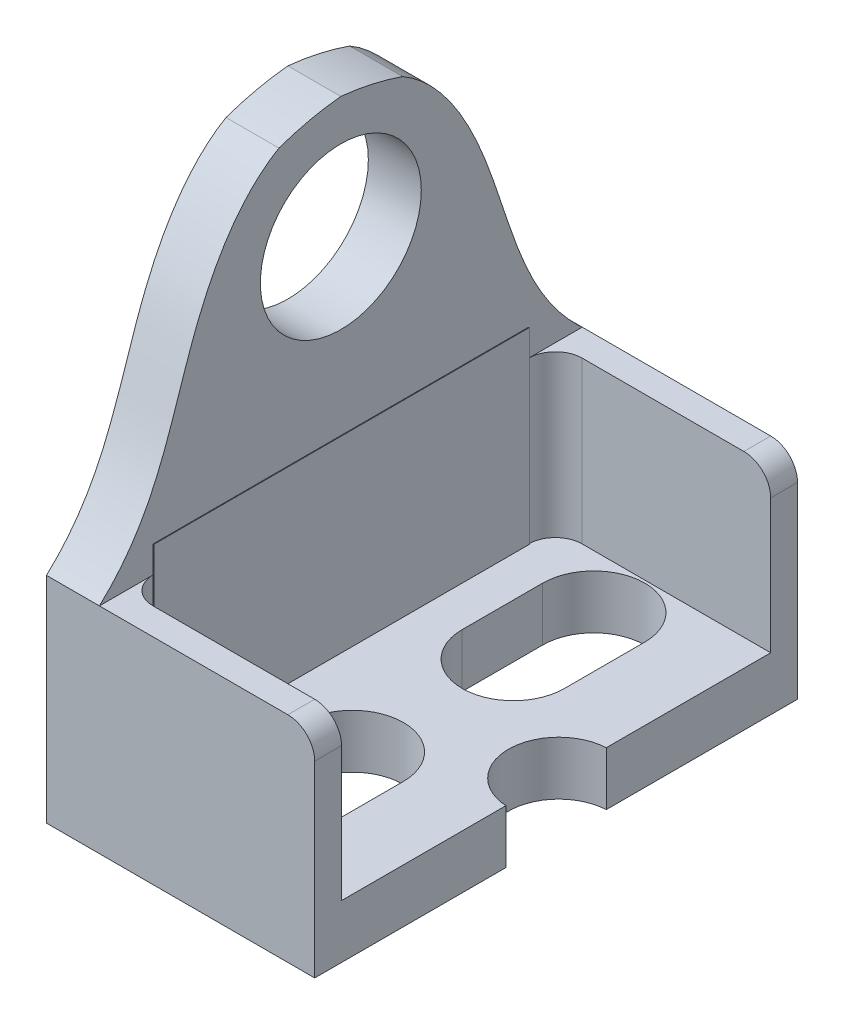
from build123d import *

# Parameters (mm, degrees)
SALIENTE_EXTRUIR1_DEPTH     = 180
REDONDEO1_R                 = 100
REDONDEO2_R                 = 10
CROQUIS2_W                  = 140
CROQUIS2_H                  = 70
CORTAR_EXTRUIR4_DEPTH       = 90
CROQUIS3_R                  = 30
CORTAR_EXTRUIR5_DEPTH       = 242.078733734
CORTAR_EXTRUIR6_DEPTH       = 282.806134391
CROQUIS5_W                  = 80.263157895
CROQUIS5_H                  = 10
CORTAR_EXTRUIR8_DEPTH       = 70
CROQUIS6_W                  = 80.263157895
CROQUIS6_H                  = 10
CORTAR_EXTRUIR9_DEPTH       = 243.676183384
REDONDEO8_R                 = 10
CORTAR_EXTRUIR10_DEPTH      = 242.078733734
CORTAR_EXTRUIR10_DEPTH_BACK = 242.078733734
CROQUIS8_W                  = 140
CROQUIS8_H                  = 70
SALIENTE_EXTRUIR2_DEPTH     = 10
CROQUIS9_R                  = 18.735611047
CORTAR_EXTRUIR11_DEPTH      = 282.806134525
REDONDEO9_R                 = 10


# Some blends are built 0.0001 mm under size
with BuildPart() as part:
    # Croquis1 → Saliente-Extruir1 (new body)
    with BuildSketch(Plane.XY):
        Polygon((-15.059146237, -60.657894737), (84.940853763, -60.657894737), (84.940853763, 29.342105263), (4.677695868, 29.342105263), (4.677695868, 139.342105263), (-15.059146237, 139.342105263), align=None)
    extrude(amount=SALIENTE_EXTRUIR1_DEPTH)

    # Redondeo1
    # the kernel refuses this fillet: 100 mm, written as the material it takes off along each edge
    with BuildSketch(Plane(origin=(254.677695868, 139.342105263, 180), x_dir=(0, 0, -1), z_dir=(-1, 0, 0))) as redondeo1_piece_1:
        with BuildLine():
            CenterArc((REDONDEO1_R, REDONDEO1_R), REDONDEO1_R, 180, 90)
            Line((0, REDONDEO1_R), (0, 0))
            Line((0, 0), (REDONDEO1_R, 0))
        make_face()
    extrude(amount=519.736842105, mode=Mode.SUBTRACT)
    with BuildSketch(Plane(origin=(254.677695868, 139.342105263, 0), x_dir=(0, 0, 1), z_dir=(-1, 0, 0))) as redondeo1_piece_2:
        with BuildLine():
            CenterArc((REDONDEO1_R, -REDONDEO1_R), REDONDEO1_R, 90, 90)
            Line((0, -REDONDEO1_R), (0, 0))
            Line((0, 0), (REDONDEO1_R, 0))
        make_face()
    extrude(amount=519.736842105, mode=Mode.SUBTRACT)

    # Redondeo2
    redondeo2_edges = [part.edges().sort_by_distance(p)[0] for p in [
        (44.809274816, 29.342105263, 180),
        (44.809274816, 29.342105263, 0),
    ]]
    fillet(redondeo2_edges, radius=REDONDEO2_R)

    # Croquis2 → Cortar-Extruir4 (cut)
    with BuildSketch(Plane(origin=(84.940853763, 0, 0), x_dir=(0, 0, -1), z_dir=(1, 0, 0))):
        with Locations((-90, -5.657894737)):
            Rectangle(CROQUIS2_W, CROQUIS2_H)
    extrude(amount=-CORTAR_EXTRUIR4_DEPTH, mode=Mode.SUBTRACT)

    # Croquis3 → Cortar-Extruir5 (cut, through all)
    with BuildSketch(Plane(origin=(4.677695868, 0, 0), x_dir=(0, 0, -1), z_dir=(1, 0, 0))):
        with Locations((-90, 93.548562432)):
            Circle(CROQUIS3_R)
    extrude(amount=-CORTAR_EXTRUIR5_DEPTH, mode=Mode.SUBTRACT)

    # Croquis4 → Cortar-Extruir6 (cut, through all)
    with BuildSketch(Plane(origin=(0, -60.657894737, 0), x_dir=(-1, 0, 0), z_dir=(0, -1, 0))):
        with BuildLine():
            Line((-58.010173511, -150), (-58.010173511, -120))
            ThreePointArc((-58.010173511, -120), (-38.975513637, -100.965340126), (-19.940853763, -120))
            Line((-19.940853763, -120), (-19.940853763, -150))
            ThreePointArc((-19.940853763, -150), (-38.975513637, -169.034659874), (-58.010173511, -150))
        make_face()
        with BuildLine():
            Line((-58.010173511, -60), (-58.010173511, -30))
            ThreePointArc((-58.010173511, -30), (-38.975513637, -10.965340126), (-19.940853763, -30))
            Line((-19.940853763, -30), (-19.940853763, -60))
            ThreePointArc((-19.940853763, -60), (-38.975513637, -79.034659874), (-58.010173511, -60))
        make_face()
    extrude(amount=-CORTAR_EXTRUIR6_DEPTH, mode=Mode.SUBTRACT)

    # Croquis5 → Cortar-Extruir8 (cut)
    with BuildSketch(Plane(origin=(0, 29.342105263, 0), x_dir=(1, 0, 0), z_dir=(0, 1, 0))):
        with Locations((44.809274816, -15)):
            Rectangle(CROQUIS5_W, CROQUIS5_H)
        with Locations((44.809274816, -165)):
            Rectangle(CROQUIS5_W, CROQUIS5_H)
    extrude(amount=-CORTAR_EXTRUIR8_DEPTH, mode=Mode.SUBTRACT)

    # Croquis6 → Cortar-Extruir9 (cut, through all)
    with BuildSketch(Plane.XY.offset(180)):
        with Locations((44.809274816, 24.342105263)):
            Rectangle(CROQUIS6_W, CROQUIS6_H)
    extrude(amount=-CORTAR_EXTRUIR9_DEPTH, mode=Mode.SUBTRACT)

    # Redondeo8
    redondeo8_edges = [part.edges().sort_by_distance(p)[0] for p in [
        (84.940853763, 19.342105263, 175),
        (84.940853763, 19.342105263, 5),
    ]]
    fillet(redondeo8_edges, radius=REDONDEO8_R)

    # Croquis7 → Cortar-Extruir10 (cut, two sides: drawn at the far end of the back side and taken through both)
    with BuildSketch(Plane(origin=(4.677695868, 0, 0), x_dir=(0, 0, -1), z_dir=(1, 0, 0)).offset(-CORTAR_EXTRUIR10_DEPTH_BACK)):
        with BuildLine():
            add(Edge.make_bspline(
                [(-113.081277055, 133.711746083), (-124.698414262, 126.957224262), (-152.328432442, 87.000878261), (-154.754506131, 42.525291557), (-180, 19.342105263)],
                knots=[0.150275034, 0.150275034, 0.150275034, 0.150275034, 0.412965146, 1, 1, 1, 1], degree=3))
            ThreePointArc((-113.081277055, 133.711746083), (-161.572445426, 97.186172783), (-180, 39.342105263))
            Line((-180, 39.342105263), (-180, 19.342105263))
        make_face()
        with BuildLine():
            ThreePointArc((0, 39.342105263), (-18.427554574, 97.186172783), (-66.918722945, 133.711746083))
            add(Edge.make_bspline(
                [(-66.918722945, 133.711746083), (-55.301585738, 126.957224262), (-27.671567558, 87.000878261), (-25.245493869, 42.525291557), (0, 19.342105263)],
                knots=[0.150275034, 0.150275034, 0.150275034, 0.150275034, 0.412965146, 1, 1, 1, 1], degree=3))
            Line((0, 19.342105263), (0, 39.342105263))
        make_face()
    extrude(amount=CORTAR_EXTRUIR10_DEPTH + CORTAR_EXTRUIR10_DEPTH_BACK, mode=Mode.SUBTRACT)

    # Croquis8 → Saliente-Extruir2 (add)
    with BuildSketch(Plane(origin=(-5.059146237, 0, 0), x_dir=(0, 0, -1), z_dir=(1, 0, 0))):
        with Locations((-90, -5.657894737)):
            Rectangle(CROQUIS8_W, CROQUIS8_H)
    extrude(amount=SALIENTE_EXTRUIR2_DEPTH)

    # Croquis9 → Cortar-Extruir11 (cut, through all)
    with BuildSketch(Plane.XZ.offset(60.657894737)):
        with Locations((85.924060677, 90)):
            Circle(CROQUIS9_R)
    extrude(amount=-CORTAR_EXTRUIR11_DEPTH, mode=Mode.SUBTRACT)

    # Redondeo9
    redondeo9_edges = [part.edges().sort_by_distance(p)[0] for p in [
        (4.677695868, -10.657894737, 170),
        (4.677695868, -10.657894737, 10),
    ]]
    fillet(redondeo9_edges, radius=REDONDEO9_R - 0.0001)  # a hair under: the kernel refuses the full size


solid = part.part
